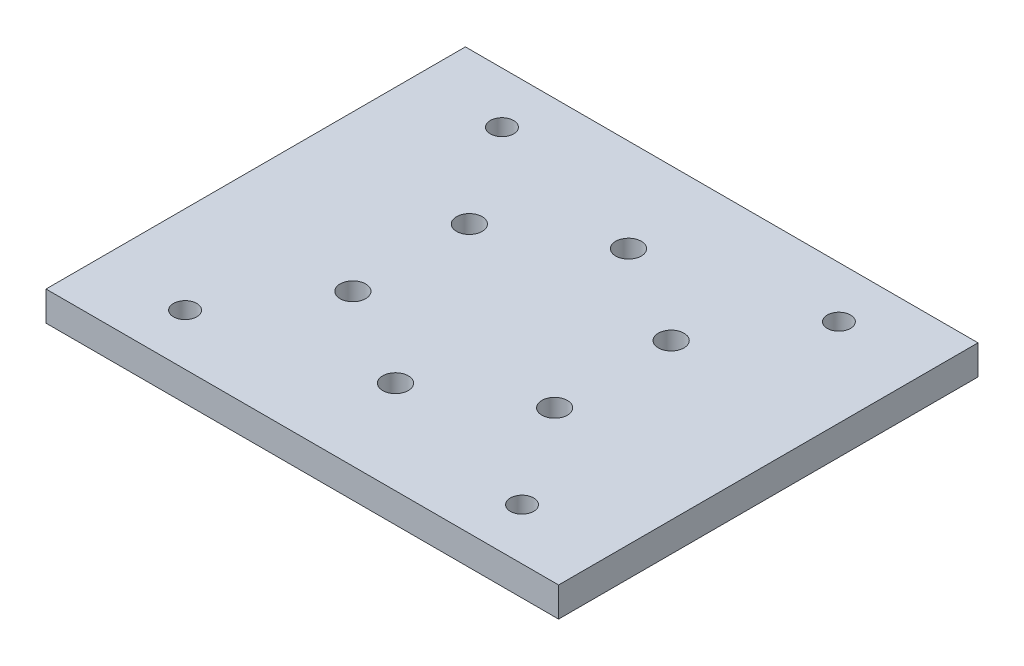
from build123d import *

# Parameters (mm, degrees)
SKETCH2_W            = 110
SKETCH2_H            = 90
BOSS_EXTRUDE1_DEPTH  = 6.35
SKETCH3_R            = 2.5
MOUNTING_HOLES_DEPTH = 143.268487375
SKETCH4_R            = 2.75
CUT_EXTRUDE1_DEPTH   = 143.268487375


with BuildPart() as part:
    # Sketch2 → Boss-Extrude1 (new body)
    with BuildSketch(Plane(origin=(0, 0, 0), x_dir=(1, 0, 0), z_dir=(0, 1, 0))):
        with Locations((55, 45)):
            Rectangle(SKETCH2_W, SKETCH2_H)
    extrude(amount=BOSS_EXTRUDE1_DEPTH)

    # Sketch3 → Mounting Holes (cut, through all)
    with BuildSketch(Plane(origin=(0, 6.35, 0), x_dir=(1, 0, 0), z_dir=(0, 1, 0))):
        with Locations((18.85, 79)):
            Circle(SKETCH3_R)
        with Locations((18.85, 11)):
            Circle(SKETCH3_R)
        with Locations((91.15, 11)):
            Circle(SKETCH3_R)
        with Locations((91.15, 79)):
            Circle(SKETCH3_R)
    extrude(amount=-MOUNTING_HOLES_DEPTH, mode=Mode.SUBTRACT)

    # Sketch4 → Cut-Extrude1 (cut, through all)
    with BuildSketch(Plane(origin=(0, 6.35, 0), x_dir=(1, 0, 0), z_dir=(0, 1, 0))):
        with Locations((55, 70)):
            Circle(SKETCH4_R)
        with Locations((76.650635095, 57.5)):
            Circle(SKETCH4_R)
        with Locations((76.650635095, 32.5)):
            Circle(SKETCH4_R)
        with Locations((55, 20)):
            Circle(SKETCH4_R)
        with Locations((33.349364905, 32.5)):
            Circle(SKETCH4_R)
        with Locations((33.349364905, 57.5)):
            Circle(SKETCH4_R)
    extrude(amount=-CUT_EXTRUDE1_DEPTH, mode=Mode.SUBTRACT)


solid = part.part
